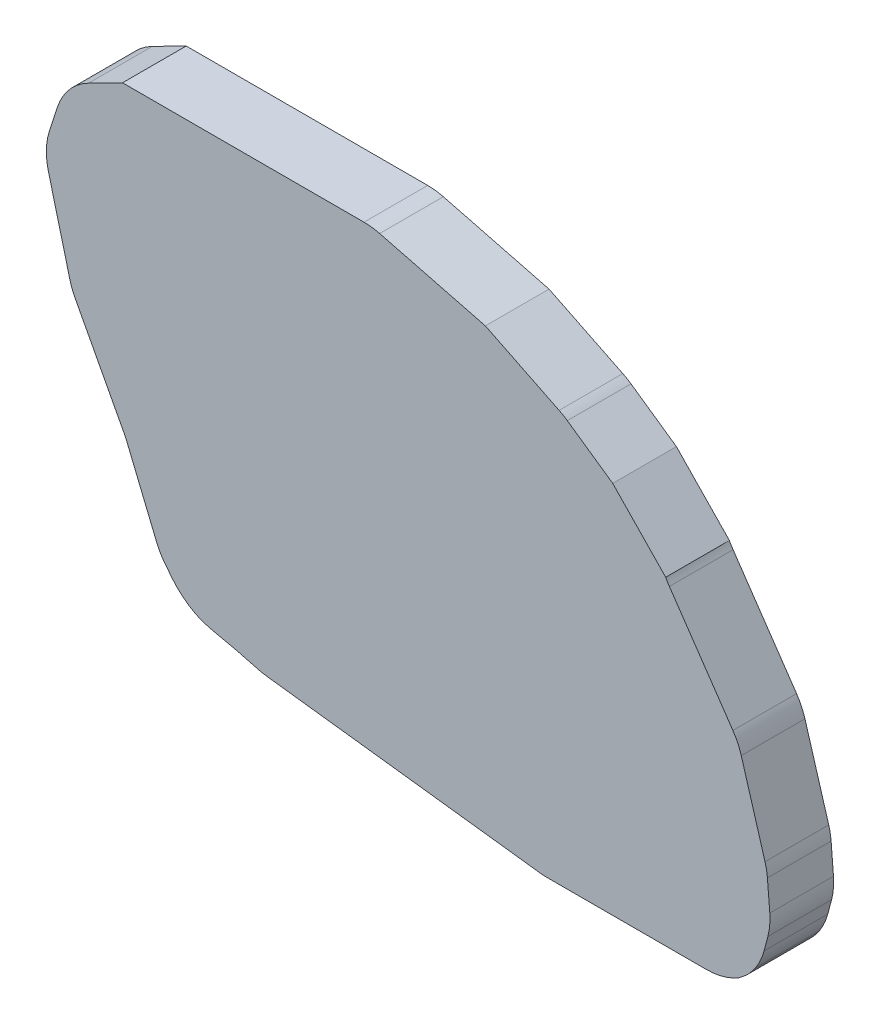
from build123d import *

# Parameters (mm, degrees)
BOSS_EXTRUDE1_DEPTH = 4
SCALE4_SCALE        = 0.75919
FILLET6_R           = 3
FILLET7_R           = 3


with BuildPart() as part:
    # Sketch1 → Boss-Extrude1 (new body)
    with BuildSketch(Plane.XY):
        Polygon((139.887521377, 204.056894723), (141.24778548, 208.242322731), (144.835713473, 210.070135105), (160.500754315, 210.070135105), (167.622266071, 208.242322731), (172.522669487, 205.831679823), (175.619724447, 203.675502319), (178.946764591, 200.233807794), (179.037084843, 200.056512483), (183.5160481, 193.501931379), (185.301557704, 187.487393826), (185.539112291, 184.563645059), (184.954362538, 182.355057305), (184.113784767, 181.109966828), (182.651910383, 180.178021908), (181.232301611, 180.178021908), (171.271612606, 180.178021908), (153.63070922, 182.355057305), (151.966131288, 182.789295026), (149.384829279, 183.363134026), (148.208709289, 184.36807152), (147.189516356, 185.643755739), (145.029311699, 190.88387399), (141.644867129, 197.274737006), align=None)
    extrude(amount=BOSS_EXTRUDE1_DEPTH)


with BuildPart() as part_1:
    # Scale4: scaled about (162.417336375, 194.870616826, 2)
    add(part.part.scale(SCALE4_SCALE).moved(Location((39.111718772, 46.926793238, 0.48162))))

    # Fillet6
    # the kernel refuses this fillet: 3 mm, written as the material it adds along each edge
    with BuildSketch(Plane(origin=(175.034883215, 198.80769695, 0.48162), x_dir=(0.5641904622979087, -0.8256446706980383, 0), z_dir=(0, 0, 1))) as fillet6_piece_1_section:
        with BuildLine():
            CenterArc((FILLET6_R * 0.0642311981219, FILLET6_R), FILLET6_R, 262.649743959, 7.350256041)
            Line((-FILLET6_R * 0.063703385216, FILLET6_R * 0.00821739156901), (0, 0))
            Line((0, 0), (FILLET6_R * 0.0642311981219, 0))
        make_face()
    fillet6_piece_1 = extrude(amount=3.03676, mode=Mode.PRIVATE)
    fillet6_piece_1 = split(fillet6_piece_1, bisect_by=Plane(origin=(175.064317261, 198.840916135, 2), z_dir=(-0.7189811970622167, -0.6950295233088893, 0)), keep=Keep.TOP, mode=Mode.PRIVATE)
    add(fillet6_piece_1)
    with BuildSketch(Plane(origin=(154.482885985, 185.698598128, 0.48162), x_dir=(-0.9761697325769959, 0.21700841734954968, 0), z_dir=(0, 0, 1))) as fillet6_piece_2:
        with BuildLine():
            CenterArc((FILLET6_R * 0.0182188067452, FILLET6_R), FILLET6_R, 267.912509474, 2.087490526)
            Line((-FILLET6_R * 0.0182067162065, FILLET6_R * 0.000663629563253), (0, 0))
            Line((0, 0), (FILLET6_R * 0.0182188067452, 0))
        make_face()
    extrude(amount=3.03676)
    with BuildSketch(Plane(origin=(149.216521921, 191.843921532, 0.48162), x_dir=(-0.4680007470830183, 0.8837280694476876, 0), z_dir=(0, 0, 1))) as fillet6_piece_3:
        with BuildLine():
            CenterArc((FILLET6_R * 0.0480422965927, FILLET6_R), FILLET6_R, 264.498987959, 5.501012041)
            Line((-FILLET6_R * 0.0478210380477, FILLET6_R * 0.00460549475516), (0, 0))
            Line((0, 0), (FILLET6_R * 0.0480422965927, 0))
        make_face()
    extrude(amount=3.03676)
    # the kernel refuses this fillet: 3 mm, written as the material it takes off along each edge
    with BuildSketch(Plane(origin=(170.089204221, 203.192146242, -0.085723646), x_dir=(0.8206934047378623, -0.5713688260832711, 0), z_dir=(0, 0, 1))) as fillet6_2_piece_1:
        with BuildLine():
            CenterArc((FILLET6_R * 0.0756458194575, -FILLET6_R), FILLET6_R, 90, 8.651894609)
            Line((-FILLET6_R * 0.0747850106227, -FILLET6_R * 0.0113794634131), (0, 0))
            Line((0, 0), (FILLET6_R * 0.0756458194575, 0))
        make_face()
    extrude(amount=4.171447292, mode=Mode.SUBTRACT)
    with BuildSketch(Plane(origin=(179.790808366, 189.265347757, -0.299334996), x_dir=(0.08098313210757263, -0.9967154720952452, 0), z_dir=(0, 0, 1))) as fillet6_2_piece_2:
        with BuildLine():
            CenterArc((FILLET6_R * 0.104127332747, -FILLET6_R), FILLET6_R, 90, 11.889267137)
            Line((-FILLET6_R * 0.101893551021, -FILLET6_R * 0.0214524051169), (0, 0))
            Line((0, 0), (FILLET6_R * 0.104127332747, 0))
        make_face()
    extrude(amount=4.598669991, mode=Mode.SUBTRACT)
    with BuildSketch(Plane(origin=(179.527221267, 185.368929193, -0.786529904), x_dir=(-0.5595376521790817, -0.8288049322934323, 0), z_dir=(0, 0, 1))) as fillet6_2_piece_3:
        with BuildLine():
            CenterArc((FILLET6_R * 0.169086653883, -FILLET6_R), FILLET6_R, 90, 19.194353316)
            Line((-FILLET6_R * 0.159686919919, -FILLET6_R * 0.0555912234793), (0, 0))
            Line((0, 0), (FILLET6_R * 0.169086653883, 0))
        make_face()
    extrude(amount=5.573059808, mode=Mode.SUBTRACT)
    with BuildSketch(Plane(origin=(178.435267329, 193.831524522, -0.693636489), x_dir=(0.2845900515763164, -0.9586493115544337, 0), z_dir=(0, 0, 1))) as fillet6_2_piece_4:
        with BuildLine():
            CenterArc((FILLET6_R * 0.156700865162, -FILLET6_R), FILLET6_R, 90, 17.811748872)
            Line((-FILLET6_R * 0.149189673688, -FILLET6_R * 0.0479333120825), (0, 0))
            Line((0, 0), (FILLET6_R * 0.156700865162, 0))
        make_face()
    extrude(amount=5.387272977, mode=Mode.SUBTRACT)
    with BuildSketch(Plane(origin=(178.88906303, 184.423668954, -1.075559702), x_dir=(-0.8432271980573246, -0.5375573387615439, 0), z_dir=(0, 0, 1))) as fillet6_2_piece_5:
        with BuildLine():
            CenterArc((FILLET6_R * 0.207623960269, -FILLET6_R), FILLET6_R, 90, 23.458660046)
            Line((-FILLET6_R * 0.190463329283, -FILLET6_R * 0.0826524595894), (0, 0))
            Line((0, 0), (FILLET6_R * 0.207623960269, 0))
        make_face()
    extrude(amount=6.151119404, mode=Mode.SUBTRACT)
    with BuildSketch(Plane(origin=(169.139414347, 183.71614569, 0.020587263), x_dir=(-0.9924710740045749, 0.12247925238261967, 0), z_dir=(0, 0, 1))) as fillet6_2_piece_6:
        with BuildLine():
            CenterArc((FILLET6_R * 0.0614710316153, -FILLET6_R), FILLET6_R, 90, 7.035208973)
            Line((-FILLET6_R * 0.0610082207674, -FILLET6_R * 0.00752892599542), (0, 0))
            Line((0, 0), (FILLET6_R * 0.0614710316153, 0))
        make_face()
    extrude(amount=3.958825474, mode=Mode.SUBTRACT)
    with BuildSketch(Plane(origin=(155.746616905, 185.368929193, -0.015587097), x_dir=(-0.9676172723968424, 0.2524218971470086, 0), z_dir=(0, 0, 1))) as fillet6_2_piece_7:
        with BuildLine():
            CenterArc((FILLET6_R * 0.0662942795425, -FILLET6_R), FILLET6_R, 90, 7.585665015)
            Line((-FILLET6_R * 0.0657141117056, -FILLET6_R * 0.00875140119136), (0, 0))
            Line((0, 0), (FILLET6_R * 0.0662942795425, 0))
        make_face()
    extrude(amount=4.031174193, mode=Mode.SUBTRACT)
    with BuildSketch(Plane(origin=(150.856527695, 187.865676157, -0.587064111), x_dir=(-0.3811282524443585, 0.9245221766884282, 0), z_dir=(0, 0, 1))) as fillet6_2_piece_8:
        with BuildLine():
            CenterArc((FILLET6_R * 0.14249121477, -FILLET6_R), FILLET6_R, 90, 16.21910898)
            Line((-FILLET6_R * 0.136820147731, -FILLET6_R * 0.0397994153417), (0, 0))
            Line((0, 0), (FILLET6_R * 0.14249121477, 0))
        make_face()
    extrude(amount=5.174128222, mode=Mode.SUBTRACT)
    with BuildSketch(Plane(origin=(151.630288778, 186.897189455, -0.231632642), x_dir=(-0.6241891196597051, 0.7812732831080572, 0), z_dir=(0, 0, 1))) as fillet6_2_piece_9:
        with BuildLine():
            CenterArc((FILLET6_R * 0.0951003522105, -FILLET6_R), FILLET6_R, 90, 10.865021551)
            Line((-FILLET6_R * 0.0933955804828, -FILLET6_R * 0.0179260295894), (0, 0))
            Line((0, 0), (FILLET6_R * 0.0951003522104, 0))
        make_face()
    extrude(amount=4.463265283, mode=Mode.SUBTRACT)
    with BuildSketch(Plane(origin=(152.523187313, 186.134250959, -1.386873198), x_dir=(-0.7602667232190712, 0.6496110448304708, 0), z_dir=(0, 0, 1))) as fillet6_2_piece_10:
        with BuildLine():
            CenterArc((FILLET6_R * 0.249132426376, -FILLET6_R), FILLET6_R, 90, 27.978899274)
            Line((-FILLET6_R * 0.220013935166, -FILLET6_R * 0.116879571377), (0, 0))
            Line((0, 0), (FILLET6_R * 0.249132426376, 0))
        make_face()
    extrude(amount=6.773746396, mode=Mode.SUBTRACT)
    with BuildSketch(Plane(origin=(177.779222616, 183.71614569, -1.705674136), x_dir=(-1, 0, 0), z_dir=(0, 0, 1))) as fillet6_2_piece_11:
        with BuildLine():
            CenterArc((FILLET6_R * 0.291639218067, -FILLET6_R), FILLET6_R, 90, 32.517510615)
            Line((-FILLET6_R * 0.245918120694, -FILLET6_R * 0.156772801943), (0, 0))
            Line((0, 0), (FILLET6_R * 0.291639218067, 0))
        make_face()
    extrude(amount=7.411348271, mode=Mode.SUBTRACT)
    with BuildSketch(Plane(origin=(146.647085448, 196.695800825, -0.397967253), x_dir=(0.4680007470830723, -0.8837280694476589, 0), z_dir=(0, 0, 1))) as fillet6_2_piece_12:
        with BuildLine():
            CenterArc((FILLET6_R * 0.117278300393, FILLET6_R), FILLET6_R, 256.622007888, 13.377992112)
            Line((-FILLET6_R * 0.114095932972, FILLET6_R * 0.027135176844), (0, 0))
            Line((0, 0), (FILLET6_R * 0.117278300394, 0))
        make_face()
    extrude(amount=4.795934506, mode=Mode.SUBTRACT)

    # Fillet7
    fillet7_edges = [part_1.edges().sort_by_distance(p)[0] for p in [
        (145.312926127, 201.844747143, 2),
        (146.345625031, 205.022282232, 2),
        (160.962286441, 206.409939108, 2),
        (179.971157433, 187.04566693, 2),
    ]]
    fillet(fillet7_edges, radius=FILLET7_R)


solid = part_1.part
